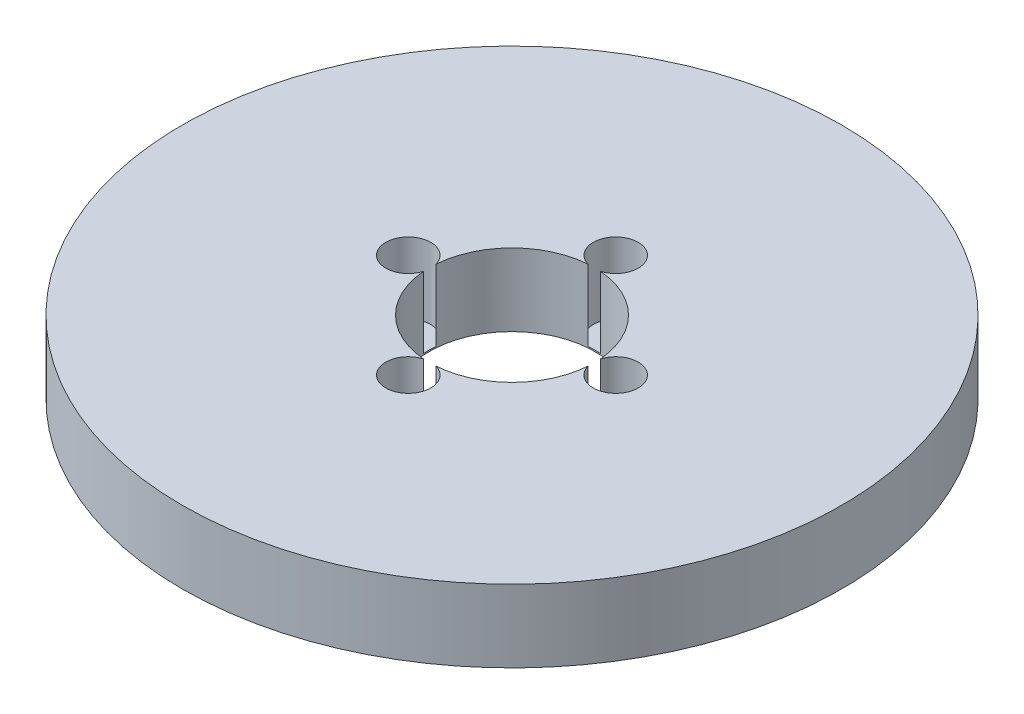
from build123d import *

# Parameters (mm, degrees)
SKETCH1_R           = 50
BOSS_EXTRUDE1_DEPTH = 11
SKETCH2_R           = 12.5
CUT_EXTRUDE1_DEPTH  = 72.561162651
SKETCH3_R           = 3.40899029
CUT_EXTRUDE2_DEPTH  = 10.803570177
CIRPATTERN1_COUNT   = 4


with BuildPart() as part:
    # Sketch1 → Boss-Extrude1 (new body)
    with BuildSketch(Plane(origin=(0, 0, 0), x_dir=(1, 0, 0), z_dir=(0, 1, 0))):
        Circle(SKETCH1_R)
    extrude(amount=BOSS_EXTRUDE1_DEPTH)

    # Sketch2 → Cut-Extrude1 (cut, through all)
    with BuildSketch(Plane(origin=(0, 0, 0), x_dir=(1, 0, 0), z_dir=(0, 1, 0))):
        Circle(SKETCH2_R)
    extrude(amount=CUT_EXTRUDE1_DEPTH, mode=Mode.SUBTRACT)

    # Sketch3 → Cut-Extrude2 (cut)
    with BuildSketch(Plane(origin=(0, 11, 0), x_dir=(1, 0, 0), z_dir=(0, 1, 0))):
        with Locations((-15.739873358, 0)):
            Circle(SKETCH3_R)
    cut_extrude2 = extrude(amount=-CUT_EXTRUDE2_DEPTH, mode=Mode.SUBTRACT)

    # CirPattern1: Cut-Extrude2 ×4 about axis
    cirpattern1_axis = Axis((0, 0, 0), (0, 1, 0))
    for i in range(1, CIRPATTERN1_COUNT):
        add(cut_extrude2.rotate(cirpattern1_axis, i * 360 / CIRPATTERN1_COUNT), mode=Mode.SUBTRACT)


solid = part.part
